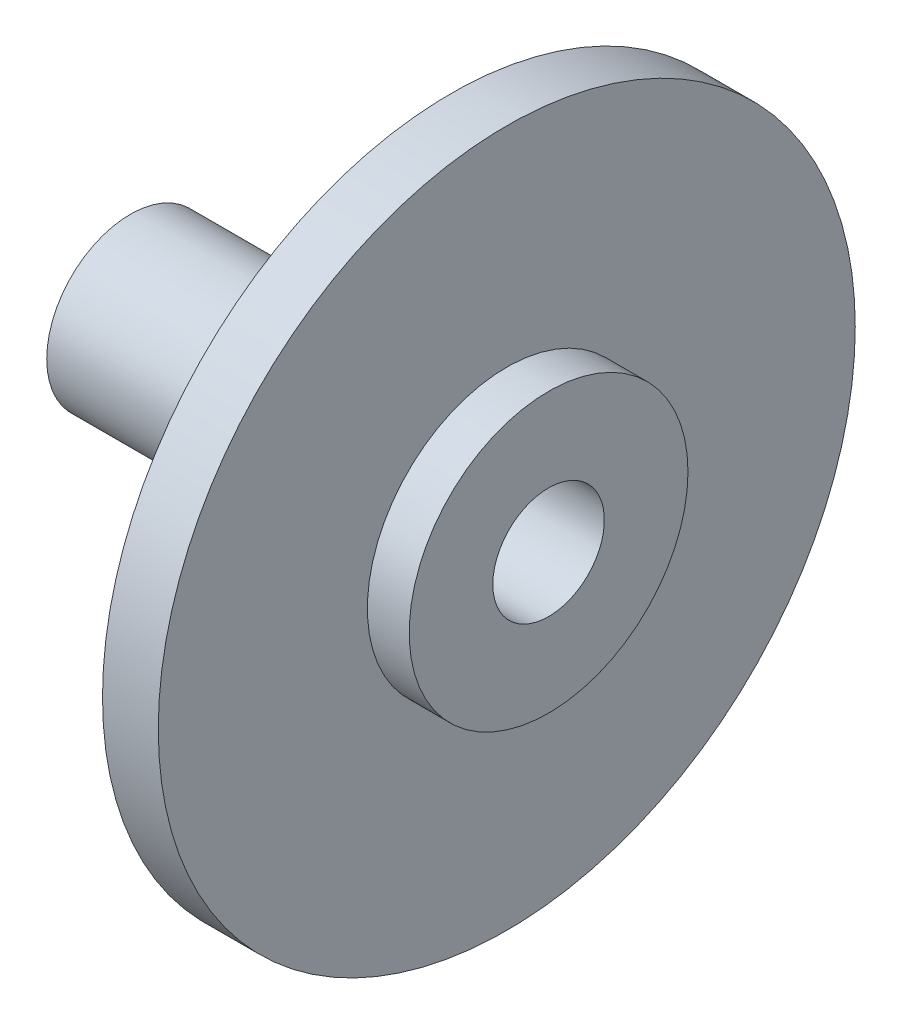
from build123d import *

# Parameters (mm, degrees)
SKETCH1_R           = 25
BOSS_EXTRUDE1_DEPTH = 2
SKETCH2_R           = 6
BOSS_EXTRUDE2_DEPTH = 23
SKETCH3_R           = 10
BOSS_EXTRUDE3_DEPTH = 3
SKETCH4_R           = 4
CUT_EXTRUDE1_DEPTH  = 30


with BuildPart() as part:
    # Sketch1 → Boss-Extrude1 (new, symmetric)
    with BuildSketch(Plane(origin=(0, 0, 0), x_dir=(0, 0, -1), z_dir=(1, 0, 0))):
        Circle(SKETCH1_R)
    extrude(amount=BOSS_EXTRUDE1_DEPTH, both=True)

    # Sketch2 → Boss-Extrude2 (add)
    with BuildSketch(Plane.ZY.offset(2)):
        Circle(SKETCH2_R)
    extrude(amount=BOSS_EXTRUDE2_DEPTH)

    # Sketch3 → Boss-Extrude3 (add)
    with BuildSketch(Plane(origin=(2, 0, 0), x_dir=(0, 0, -1), z_dir=(1, 0, 0))):
        Circle(SKETCH3_R)
    extrude(amount=BOSS_EXTRUDE3_DEPTH)

    # Sketch4 → Cut-Extrude1 (cut)
    with BuildSketch(Plane.ZY.offset(25)):
        Circle(SKETCH4_R)
    extrude(amount=-CUT_EXTRUDE1_DEPTH, mode=Mode.SUBTRACT)


solid = part.part
